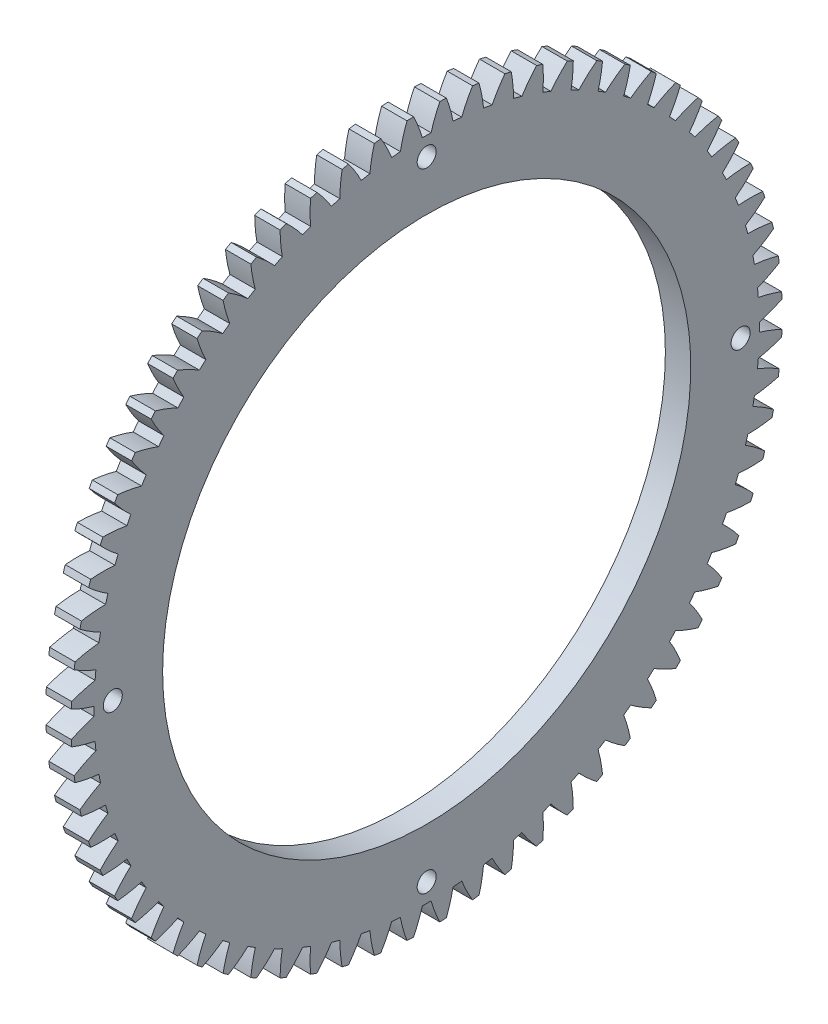
from build123d import *

# Parameters (mm, degrees)
BASPROSKE_W        = 6.35
BASPROSKE_H        = 88.9
TOOTHCUT_DEPTH     = 126.88384527
TEETHCUTS_COUNT    = 68
TEETHCUTS_ANGLE    = 354.705882353
BORSKE_R           = 66.04
BORE_DEPTH         = 50.8000508
SKETCH2_R          = 2.38125
CUT_EXTRUDE1_DEPTH = 126.797981639


with BuildPart() as part:
    # BasProSke → Base-Revolve (revolve)
    with BuildSketch(Plane(origin=(0, 0, 0), x_dir=(1, 0, 0), z_dir=(0, 1, 0))):
        with Locations((3.175, 44.45)):
            Rectangle(BASPROSKE_W, BASPROSKE_H)
    revolve(axis=Axis((-10, 0, 0), (1, 0, 0)))

    # TooCutSke → ToothCut (cut, through all)
    with BuildSketch(Plane(origin=(0, 0, 0), x_dir=(0, 0, -1), z_dir=(1, 0, 0))):
        with BuildLine():
            ThreePointArc((1.090121141, 83.176586685), (0, 83.18373), (-1.090121141, 83.176586685))
            ThreePointArc((-1.090121141, 83.176586685), (-2.06895849, 86.069252988), (-3.299441274, 88.864168552))
            ThreePointArc((-3.299441274, 88.864168552), (0, 88.9254), (3.299441274, 88.864168552))
            ThreePointArc((3.299441274, 88.864168552), (2.06895849, 86.069252988), (1.090121141, 83.176586685))
        make_face()
    toothcut = extrude(amount=TOOTHCUT_DEPTH, mode=Mode.SUBTRACT)

    # TeethCuts: ToothCut ×68 about axis
    teethcuts_axis = Axis((-10, 0, 0), (1, 0, 0))
    for i in range(1, TEETHCUTS_COUNT):
        add(toothcut.rotate(teethcuts_axis, i * TEETHCUTS_ANGLE / (TEETHCUTS_COUNT - 1)), mode=Mode.SUBTRACT)

    # BorSke → Bore (cut, symmetric)
    with BuildSketch(Plane(origin=(0, 0, 0), x_dir=(0, 0, -1), z_dir=(1, 0, 0))):
        Circle(BORSKE_R)
    extrude(amount=BORE_DEPTH, both=True, mode=Mode.SUBTRACT)

    # Sketch2 → Cut-Extrude1 (cut, through all)
    with BuildSketch(Plane(origin=(6.35, 0, 0), x_dir=(0, 0, -1), z_dir=(1, 0, 0))):
        with Locations((0, 78.499999972)):
            Circle(SKETCH2_R)
        with Locations((78.499999972, 0)):
            Circle(SKETCH2_R)
        with Locations((0, -78.499999972)):
            Circle(SKETCH2_R)
        with Locations((-78.499999972, 0)):
            Circle(SKETCH2_R)
    extrude(amount=-CUT_EXTRUDE1_DEPTH, mode=Mode.SUBTRACT)


solid = part.part
